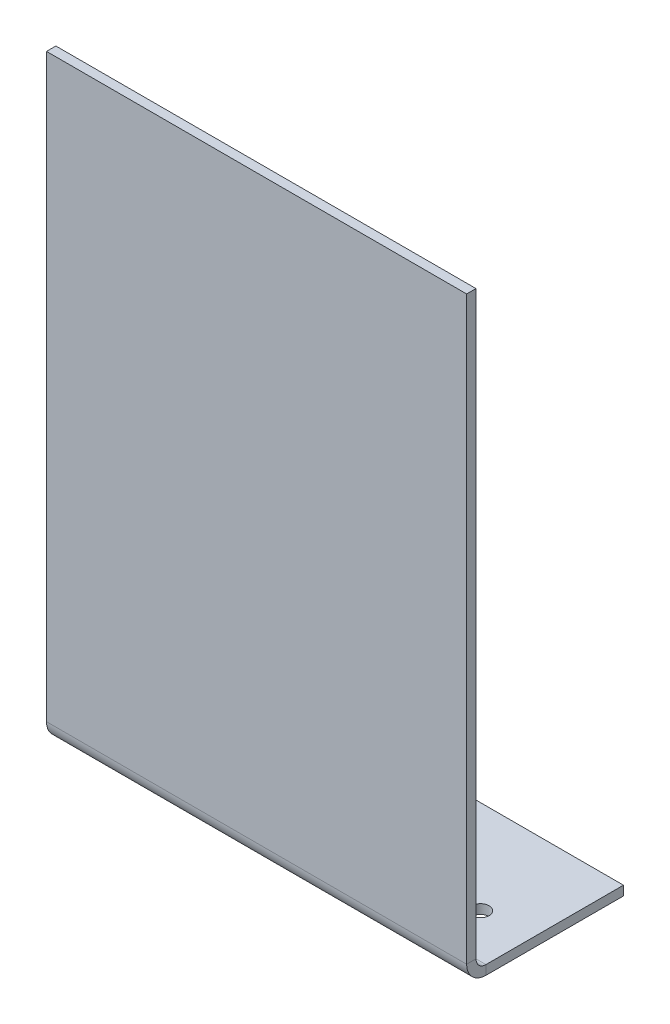
from build123d import *

# Parameters (mm, degrees)
SKETCH1_W              = 71.89414
SKETCH1_H              = 126.6
SKETCH1_R              = 1.4732
BASE_FLANGE1_DEPTH     = 1.6002
SKETCHED_BEND1_DEPTH   = 71.89414
SKETCHED_BEND1_2_DEPTH = 71.89414


# Read off the part's stored shape, not the designer's step: Sketched Bend1
# Sheet-metal steps are written as plain solids
with BuildPart() as part:
    # Sketch1 → Base-Flange1 (new body)
    with BuildSketch(Plane(origin=(0, 0, 0), x_dir=(1, 0, 0), z_dir=(0, 1, 0))):
        with Locations((35.94707, -63.3)):
            Rectangle(SKETCH1_W, SKETCH1_H)
        with Locations(Location((8.44707, -16.01, 0), (0, 0, 270))):
            Circle(SKETCH1_R, mode=Mode.SUBTRACT)
        with Locations(Location((63.44707, -16.01, 0), (0, 0, 270))):
            Circle(SKETCH1_R, mode=Mode.SUBTRACT)
    extrude(amount=-BASE_FLANGE1_DEPTH)

    # Sketched Bend1 outline → Sketched Bend1 (cut)
    with BuildSketch(Plane.YZ):
        with BuildLine():
            ThreePointArc((-1.6002, 23.536969583), (-1.172425807, 25.16192805), (0, 26.36563005))
            Line((0, 26.36563005), (0, 126.6))
            Line((0, 126.6), (-1.6002, 126.6))
            Line((-1.6002, 126.6), (-1.6002, 23.536969583))
        make_face()
    extrude(amount=SKETCHED_BEND1_DEPTH, mode=Mode.SUBTRACT)

    # Sketched Bend1 2 outline → Sketched Bend1 2 (add)
    with BuildSketch(Plane.YZ):
        with BuildLine():
            ThreePointArc((0, 23.536969583), (0.497918472, 24.739051111), (1.7, 25.236969583))
            Line((1.7, 25.236969583), (101.036969583, 25.236969583))
            Line((101.036969583, 25.236969583), (101.036969583, 26.837169583))
            Line((101.036969583, 26.837169583), (1.7, 26.837169583))
            ThreePointArc((1.7, 26.837169583), (0.817907384, 26.717100501), (0, 26.36563005))
            Line((0, 26.36563005), (0, 23.536969583))
        make_face()
    extrude(amount=SKETCHED_BEND1_2_DEPTH)


solid = part.part
